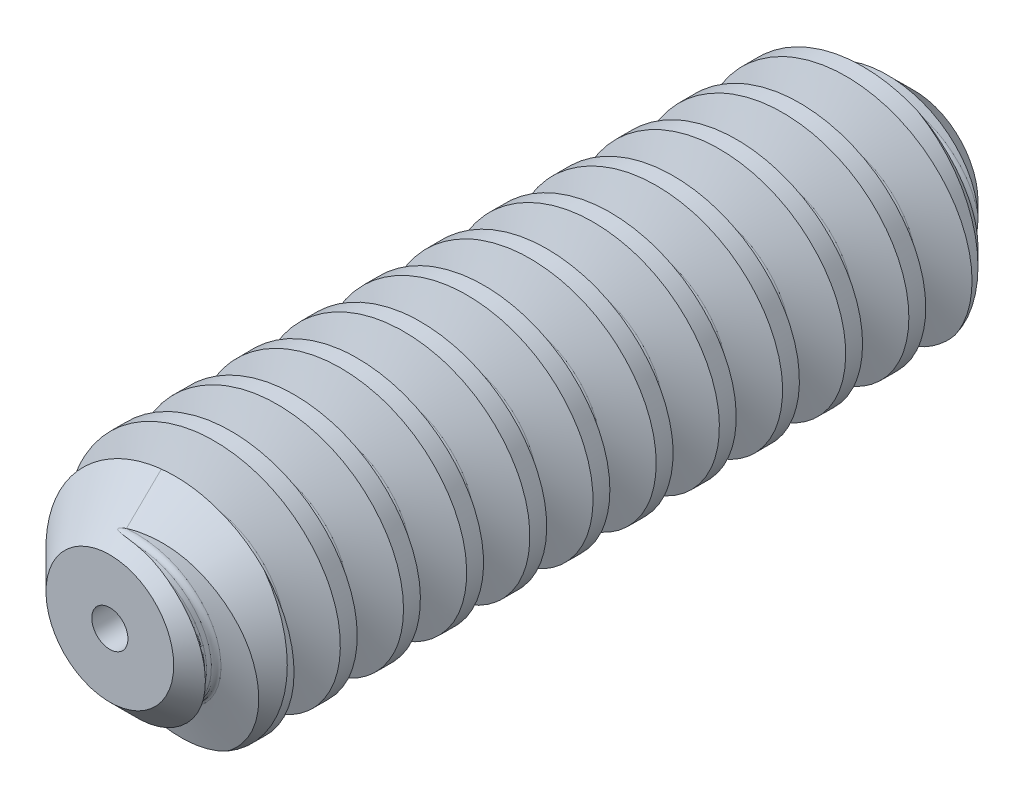
from build123d import *

# Parameters (mm, degrees)
TOOTHCUTWORM01_PITCH = 1.570796303
SKETCH7_R            = 0.45
CUT_EXTRUDE2_DEPTH   = 20


with BuildPart() as part:
    # SketchRevolveWorm01 → Worm01 (revolve)
    with BuildSketch(Plane(origin=(0, 0, 0), x_dir=(0, 0, -1), z_dir=(1, 0, 0)), mode=Mode.PRIVATE) as worm01_sk:
        Polygon((10, 0), (10, 1.587760014), (8.587760021, 2.999999992), (-8.587760021, 2.999999992), (-10, 1.587760014), (-10, 0), align=None)
    revolve(worm01_sk.sketch.rotate(Axis((0, 0, 0), (0, 0, -1)), 90), axis=Axis((0, 0, 0), (0, 0, -1)))

    # ToothCutWorm01: the profile of SketchToothWorm01 screwed along a right-hand helix of 14 turns, 8 arcs to a turn; built about Z, then put on its axis
    toothcutworm01_z = Axis((0, 0, 0), (0, 0, 1))
    toothcutworm01_corners = [(3.124999991, 0, 0.621413516), (1.973451665, 0, 0.200012341), (1.875000009, 0, 0.059147981), (1.875000009, 0, -0.059147981), (1.973451665, 0, -0.200012341), (3.124999991, 0, -0.621413516)]
    with BuildLine(mode=Mode.PRIVATE) as toothcutworm01_profile:
        Line(toothcutworm01_corners[0], toothcutworm01_corners[1])
        Line(toothcutworm01_corners[2], toothcutworm01_corners[3])
        Line(toothcutworm01_corners[4], toothcutworm01_corners[5])
        Line(toothcutworm01_corners[5], toothcutworm01_corners[0])
        ThreePointArc((1.973451665, 0, 0.200012341), (1.902052355, 0, 0.145077453), (1.875000009, 0, 0.059147981))
        ThreePointArc((1.875000009, 0, -0.059147981), (1.902052355, 0, -0.145077453), (1.973451665, 0, -0.200012341))
    toothcutworm01_cap = Face(toothcutworm01_profile.wire())
    toothcutworm01_arcs = [((1.973451665, 0, 0.200012341), (1.875000009, 0, 0.163984635), (1.875000009, 0, 0.059147981), (1, 0.819651028585465, 1)), ((1.875000009, 0, -0.059147981), (1.875000009, 0, -0.163984635), (1.973451665, 0, -0.200012341), (1, 0.8196510285854693, 1))]  # start, shoulder, end, weights
    toothcutworm01_turn_angles = [0, 22.5, 45, 67.5, 90, 112.5, 135, 157.5, 180, 202.5, 225, 247.5, 270, 292.5, 315, 337.5, 360]
    toothcutworm01_turn_weights = [1, 0.9238795325112867, 1, 0.9238795325112867, 1, 0.9238795325112867, 1, 0.9238795325112867, 1, 0.9238795325112867, 1, 0.9238795325112867, 1, 0.9238795325112867, 1, 0.9238795325112867, 1]
    toothcutworm01_turn_rails = [Edge.make_bspline([Vector(p[0], p[1], 0).rotate(toothcutworm01_z, toothcutworm01_turn_angles[k]) / toothcutworm01_turn_weights[k] + Vector(0, 0, p[2] + TOOTHCUTWORM01_PITCH * toothcutworm01_turn_angles[k] / 360) for k in range(17)], [0, 0, 0, 1, 1, 2, 2, 3, 3, 4, 4, 5, 5, 6, 6, 7, 7, 8, 8, 8], 2, toothcutworm01_turn_weights) for p in toothcutworm01_corners]
    toothcutworm01_turn_sides = [*[Face.make_surface_from_curves(toothcutworm01_turn_rails[p[0]], toothcutworm01_turn_rails[p[1]]) for p in [(0, 1), (2, 3), (4, 5), (5, 0)]], *[Face.make_bezier_surface([[Vector(p[j][0], p[j][1], 0).rotate(toothcutworm01_z, toothcutworm01_turn_angles[2 * i + k]) / toothcutworm01_turn_weights[2 * i + k] + Vector(0, 0, p[j][2] + TOOTHCUTWORM01_PITCH * toothcutworm01_turn_angles[2 * i + k] / 360) for k in range(3)] for j in range(3)], [[p[3][j] * toothcutworm01_turn_weights[2 * i + k] for k in range(3)] for j in range(3)]) for p in toothcutworm01_arcs for i in range(8)]]
    toothcutworm01 = Plane(origin=(0, 0, 10.995574122), x_dir=(1, 0, 0), z_dir=(0, 0, -1)) * Solid(Shell([*[p.moved(Location((0, 0, TOOTHCUTWORM01_PITCH * i))) for i in range(14) for p in toothcutworm01_turn_sides], toothcutworm01_cap, toothcutworm01_cap.rotate(toothcutworm01_z, 5040).moved(Location((0, 0, TOOTHCUTWORM01_PITCH * 5040 / 360)))]))
    add(toothcutworm01, mode=Mode.SUBTRACT)

    # Sketch7 → Cut-Extrude2 (cut)
    with BuildSketch(Plane.XY.offset(10)):
        Circle(SKETCH7_R)
    extrude(amount=-CUT_EXTRUDE2_DEPTH, mode=Mode.SUBTRACT)


solid = part.part
